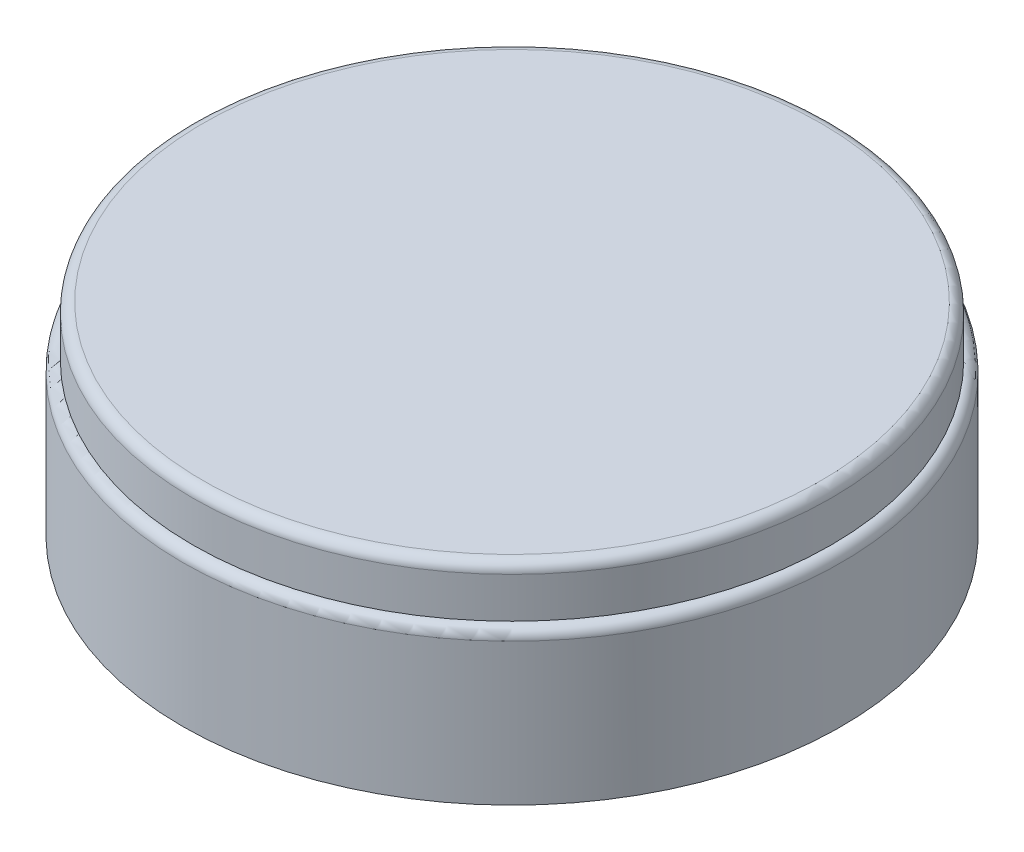
from build123d import *

# Parameters (mm, degrees)
CONG_1_R         = 1
CONG_2_R         = 1
COQUE3_OUTLINE_R = 30.5
COQUE3_DEPTH     = 19


# Read off the part's stored shape, not the designer's step: Coque3
with BuildPart() as part:
    # Esquisse1 → Révolution1 (revolve)
    with BuildSketch(Plane.XY, mode=Mode.PRIVATE) as r_volution1_sk:
        Polygon((0, 0), (32.5, 0), (32.5, 15), (31.5, 15), (31.5, 20), (0, 20), align=None)
    revolve(r_volution1_sk.sketch.rotate(Axis((0, 0, 0), (0, -1, 0)), 90), axis=Axis((0, 0, 0), (0, -1, 0)))

    # Congé1
    cong_1_edges = [part.edges().sort_by_distance(p)[0] for p in [
        (0, 20, -31.5),
    ]]
    fillet(cong_1_edges, radius=CONG_1_R)

    # Congé2
    cong_2_edges = [part.edges().sort_by_distance(p)[0] for p in [
        (0, 15, -32.5),
    ]]
    fillet(cong_2_edges, radius=CONG_2_R - 0.0001)  # a hair under: the kernel refuses the full size

    # Coque3 outline → Coque3 (cut)
    with BuildSketch(Plane(origin=(0, 0, 0), x_dir=(1, 0, 0), z_dir=(0, 1, 0))):
        Circle(COQUE3_OUTLINE_R)
    extrude(amount=COQUE3_DEPTH, mode=Mode.SUBTRACT)


solid = part.part
